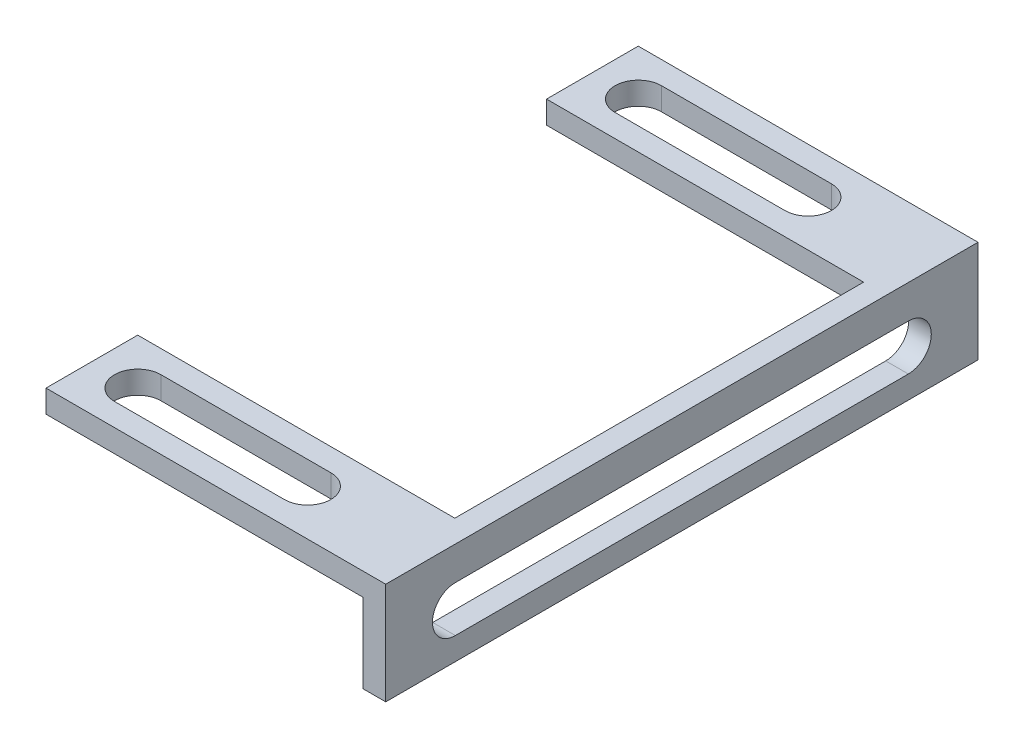
from build123d import *

# Parameters (mm, degrees)
SKETCH1_W           = 28
SKETCH1_H           = 26.15
BOSS_EXTRUDE1_DEPTH = 2
SKETCH12_W          = 52.3
SKETCH12_H          = 9
BOSS_EXTRUDE2_DEPTH = 2
SKETCH13_W          = 30
SKETCH13_H          = 36.1
CUT_EXTRUDE3_DEPTH  = 2
SKETCH15_W          = 2
SKETCH15_H          = 36.1
BOSS_EXTRUDE3_DEPTH = 2


with BuildPart() as part:
    # Sketch1 → Boss-Extrude1 (new body)
    # profile 1 of 2: a face of its own
    with BuildSketch(Plane(origin=(0, 0, 0), x_dir=(1, 0, 0), z_dir=(0, 1, 0))):
        with Locations((14, 39.225)):
            Rectangle(SKETCH1_W, SKETCH1_H)
        with BuildLine():
            Line((19.05, 46.2), (4.05, 46.2))
            ThreePointArc((4.05, 46.2), (2, 48.25), (4.05, 50.3))
            Line((4.05, 50.3), (19.05, 50.3))
            ThreePointArc((19.05, 50.3), (21.1, 48.25), (19.05, 46.2))
        make_face(mode=Mode.SUBTRACT)
    # profile 2 of 2: a face of its own
    with BuildSketch(Plane(origin=(0, 0, 0), x_dir=(1, 0, 0), z_dir=(0, 1, 0))):
        with Locations((14, 13.075)):
            Rectangle(SKETCH1_W, SKETCH1_H)
        with BuildLine():
            ThreePointArc((4.05, 2), (2, 4.05), (4.05, 6.1))
            Line((4.05, 6.1), (19.05, 6.1))
            ThreePointArc((19.05, 6.1), (21.1, 4.05), (19.05, 2))
            Line((19.05, 2), (4.05, 2))
        make_face(mode=Mode.SUBTRACT)
    extrude(amount=BOSS_EXTRUDE1_DEPTH)

    # Sketch12 → Boss-Extrude2 (add)
    with BuildSketch(Plane(origin=(28, 0, 0), x_dir=(0, 0, -1), z_dir=(1, 0, 0))):
        with Locations((26.15, -2.5)):
            Rectangle(SKETCH12_W, SKETCH12_H)
        with BuildLine():
            Line((6.15, -0.95), (46.15, -0.95))
            ThreePointArc((46.15, -0.95), (48.175, -2.975), (46.15, -5))
            Line((46.15, -5), (6.15, -5))
            ThreePointArc((6.15, -5), (4.125, -2.975), (6.15, -0.95))
        make_face(mode=Mode.SUBTRACT)
    extrude(amount=BOSS_EXTRUDE2_DEPTH)

    # Sketch13 → Cut-Extrude3 (cut)
    with BuildSketch(Plane(origin=(0, 2, 0), x_dir=(1, 0, 0), z_dir=(0, 1, 0))):
        with Locations((15, 26.15)):
            Rectangle(SKETCH13_W, SKETCH13_H)
    extrude(amount=-CUT_EXTRUDE3_DEPTH, mode=Mode.SUBTRACT)

    # Sketch15 → Boss-Extrude3 (add)
    with BuildSketch(Plane(origin=(0, 0, 0), x_dir=(1, 0, 0), z_dir=(0, 1, 0))):
        with Locations((29, 26.15)):
            Rectangle(SKETCH15_W, SKETCH15_H)
    extrude(amount=BOSS_EXTRUDE3_DEPTH)


solid = part.part
